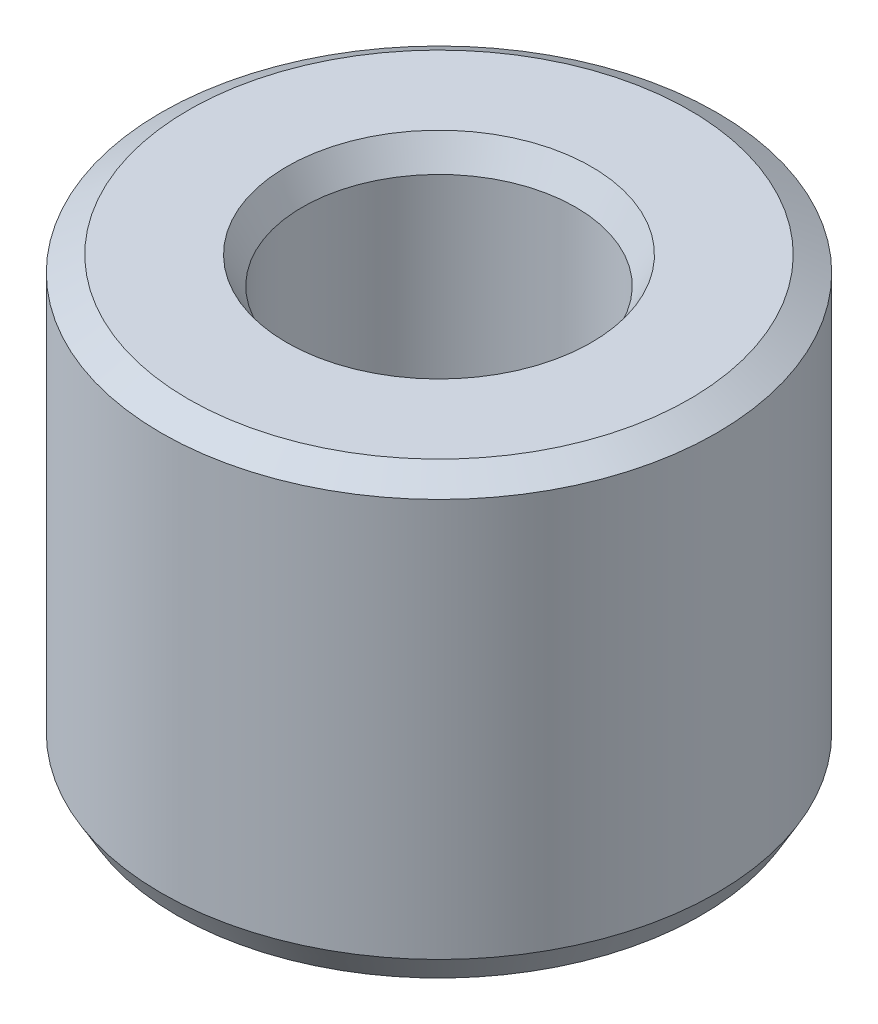
from build123d import *
from OCP.BRepFilletAPI import BRepFilletAPI_MakeChamfer

# Parameters (mm, degrees)
SKETCH1_R           = 35
BOSS_EXTRUDE1_DEPTH = 55.620242208
SKETCH2_R           = 17.225289551
CUT_EXTRUDE1_DEPTH  = 75.455431926
CHAMFER1_SIZE       = 1.979433854
CHAMFER1_SIZE2      = 3.428480005


with BuildPart() as part:
    # Sketch1 → Boss-Extrude1 (new body)
    with BuildSketch(Plane(origin=(0, 0, 0), x_dir=(1, 0, 0), z_dir=(0, 1, 0))):
        Circle(SKETCH1_R)
    extrude(amount=BOSS_EXTRUDE1_DEPTH)

    # Sketch2 → Cut-Extrude1 (cut, through all)
    with BuildSketch(Plane(origin=(0, 0, 0), x_dir=(1, 0, 0), z_dir=(0, 1, 0))):
        Circle(SKETCH2_R)
    extrude(amount=CUT_EXTRUDE1_DEPTH, mode=Mode.SUBTRACT)

    # Chamfer1: one chamfer whose edges measure the first distance from different faces: ONE call of the kernel's chamfer builder (chamfer() names one face for all edges)
    chamfer1_edges_1 = [part.edges().sort_by_distance(p)[0] for p in [
        (-17.225289551, 55.620242208, 0),
    ]]
    chamfer1_side_1 = [part.faces().sort_by_distance(p)[0] for p in [
        (-34.010050506, 55.620242208, 0),
    ]]
    chamfer1_edges_2 = [part.edges().sort_by_distance(p)[0] for p in [
        (-17.225289551, 0, 0),
    ]]
    chamfer1_side_2 = [part.faces().sort_by_distance(p)[0] for p in [
        (-17.225289551, 27.810121104, 0),
    ]]
    chamfer1_edges_3 = [part.edges().sort_by_distance(p)[0] for p in [
        (-35, 0, 0),
    ]]
    chamfer1_side_3 = [part.faces().sort_by_distance(p)[0] for p in [
        (-34.010050506, 0, 0),
    ]]
    chamfer1_edges_4 = [part.edges().sort_by_distance(p)[0] for p in [
        (-35, 55.620242208, 0),
    ]]
    chamfer1_side_4 = [part.faces().sort_by_distance(p)[0] for p in [
        (-35, 27.810121104, 0),
    ]]
    chamfer1 = BRepFilletAPI_MakeChamfer(part.part.solid().wrapped)
    for e in chamfer1_edges_1:
        chamfer1.Add(CHAMFER1_SIZE, CHAMFER1_SIZE2, e.wrapped, chamfer1_side_1[0].wrapped)  # the first distance lies on this face
    for e in chamfer1_edges_2:
        chamfer1.Add(CHAMFER1_SIZE, CHAMFER1_SIZE2, e.wrapped, chamfer1_side_2[0].wrapped)  # the first distance lies on this face
    for e in chamfer1_edges_3:
        chamfer1.Add(CHAMFER1_SIZE, CHAMFER1_SIZE2, e.wrapped, chamfer1_side_3[0].wrapped)  # the first distance lies on this face
    for e in chamfer1_edges_4:
        chamfer1.Add(CHAMFER1_SIZE, CHAMFER1_SIZE2, e.wrapped, chamfer1_side_4[0].wrapped)  # the first distance lies on this face
    add(Compound.cast(chamfer1.Shape()), mode=Mode.REPLACE)


solid = part.part
